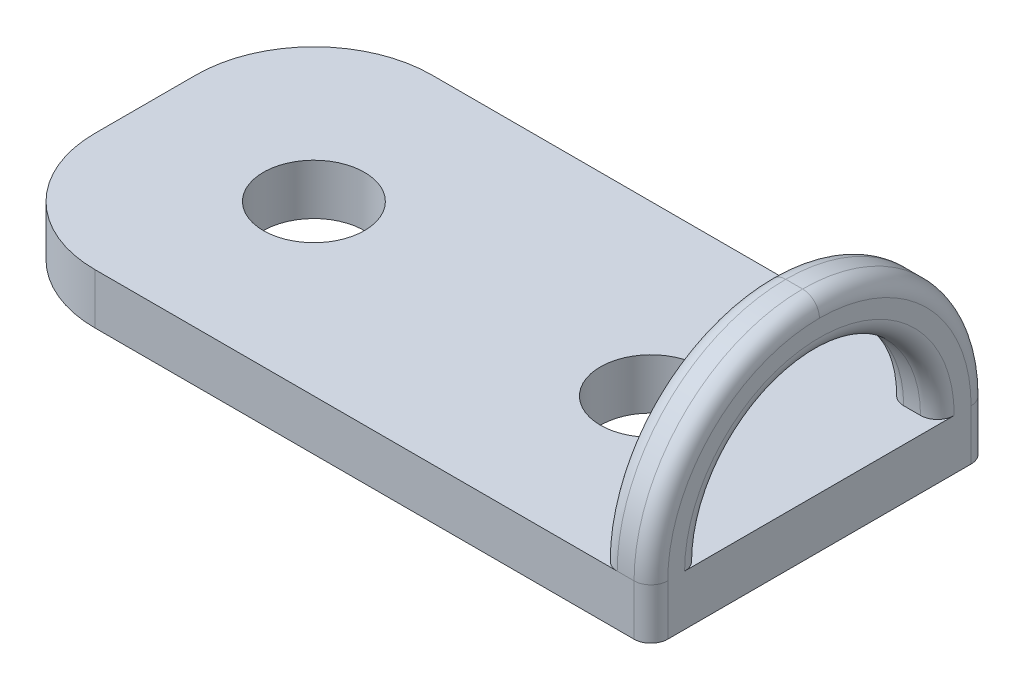
from build123d import *

# Parameters (mm, degrees)
SKETCH1_R           = 3
BOSS_EXTRUDE1_DEPTH = 3
SKETCH2_W           = 3
SKETCH2_H           = 20
BOSS_EXTRUDE2_DEPTH = 10
FILLET1_R           = 10
CUT_EXTRUDE1_DEPTH  = 45.022721406
FILLET2_R           = 1


with BuildPart() as part:
    # Sketch1 → Boss-Extrude1 (new body)
    with BuildSketch(Plane(origin=(0, 0, 0), x_dir=(1, 0, 0), z_dir=(0, 1, 0))):
        with BuildLine():
            Line((0, 0), (-33, 0))
            ThreePointArc((-33, 0), (-37.949747468, -2.050252532), (-40, -7))
            Line((-40, -7), (-40, -13))
            ThreePointArc((-40, -13), (-37.949747468, -17.949747468), (-33, -20))
            Line((-33, -20), (0, -20))
            Line((0, -20), (0, 0))
        make_face()
        with Locations(Location((-30, -10, 0), (0, 0, 270))):
            Circle(SKETCH1_R, mode=Mode.SUBTRACT)
        with Locations(Location((-10, -10, 0), (0, 0, 270))):
            Circle(SKETCH1_R, mode=Mode.SUBTRACT)
    extrude(amount=BOSS_EXTRUDE1_DEPTH)

    # Sketch2 → Boss-Extrude2 (add)
    with BuildSketch(Plane(origin=(0, 3, 0), x_dir=(1, 0, 0), z_dir=(0, 1, 0))):
        with Locations((-1.5, -10)):
            Rectangle(SKETCH2_W, SKETCH2_H)
    extrude(amount=BOSS_EXTRUDE2_DEPTH)

    # Fillet1
    fillet1_edges = [part.edges().sort_by_distance(p)[0] for p in [
        (-1.5, 13, 0),
        (-1.5, 13, 20),
    ]]
    fillet(fillet1_edges, radius=FILLET1_R - 0.0001)  # a hair under: the kernel refuses the full size

    # Sketch3 → Cut-Extrude1 (cut, through all)
    with BuildSketch(Plane.ZY.offset(3)):
        with BuildLine():
            Line((3, 3), (17, 3))
            ThreePointArc((17, 3), (10, 10), (3, 3))
        make_face()
    extrude(amount=-CUT_EXTRUDE1_DEPTH, mode=Mode.SUBTRACT)

    # Fillet2
    fillet2_edges = [part.edges().sort_by_distance(p)[0] for p in [
        (-3, 10.071097101, 17.071097101),
        (-3, 10.071097101, 2.928902899),
        (0, 1.50005, 0),
        (0, 1.50005, 20),
        (0, 10.071097101, 17.071097101),
        (0, 10.071097101, 2.928902899),
        (0, 10, 10),
        (-3, 10, 10),
    ]]
    fillet(fillet2_edges, radius=FILLET2_R)


solid = part.part
